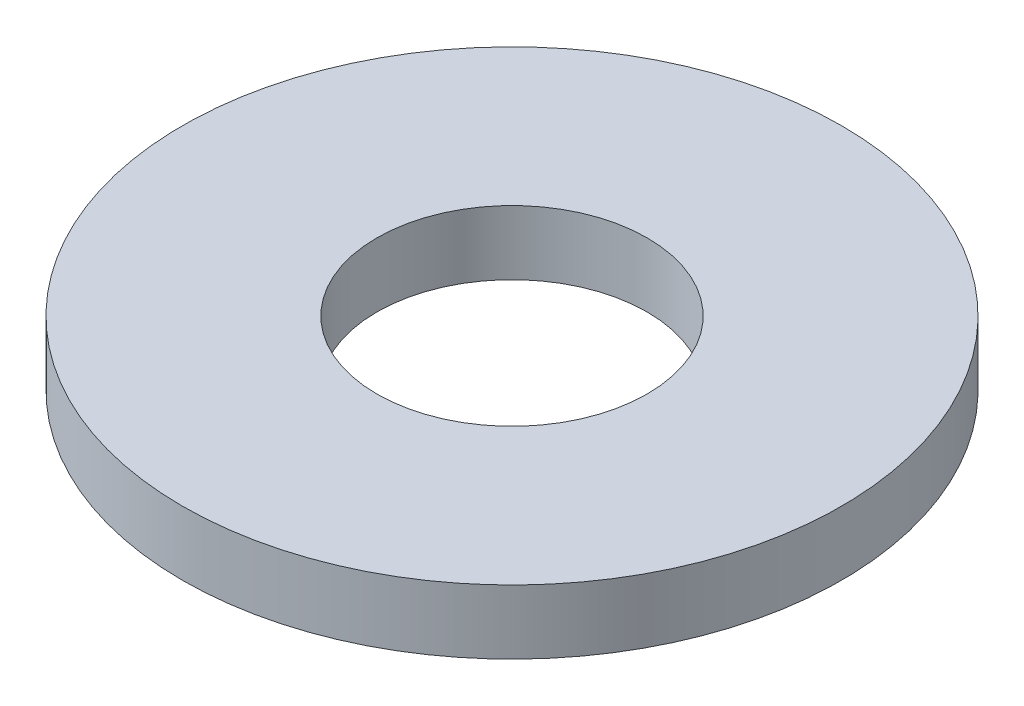
from build123d import *

# Parameters (mm, degrees)
SKETCH1_R           = 97.5
BOSS_EXTRUDE1_DEPTH = 19
SKETCH2_R           = 40
CUT_EXTRUDE1_DEPTH  = 140.188720807


with BuildPart() as part:
    # Sketch1 → Boss-Extrude1 (new body)
    with BuildSketch(Plane(origin=(0, 0, 0), x_dir=(1, 0, 0), z_dir=(0, 1, 0))):
        Circle(SKETCH1_R)
    extrude(amount=BOSS_EXTRUDE1_DEPTH)

    # Sketch2 → Cut-Extrude1 (cut, through all)
    with BuildSketch(Plane(origin=(0, 0, 0), x_dir=(1, 0, 0), z_dir=(0, 1, 0))):
        Circle(SKETCH2_R)
    extrude(amount=CUT_EXTRUDE1_DEPTH, mode=Mode.SUBTRACT)


solid = part.part
